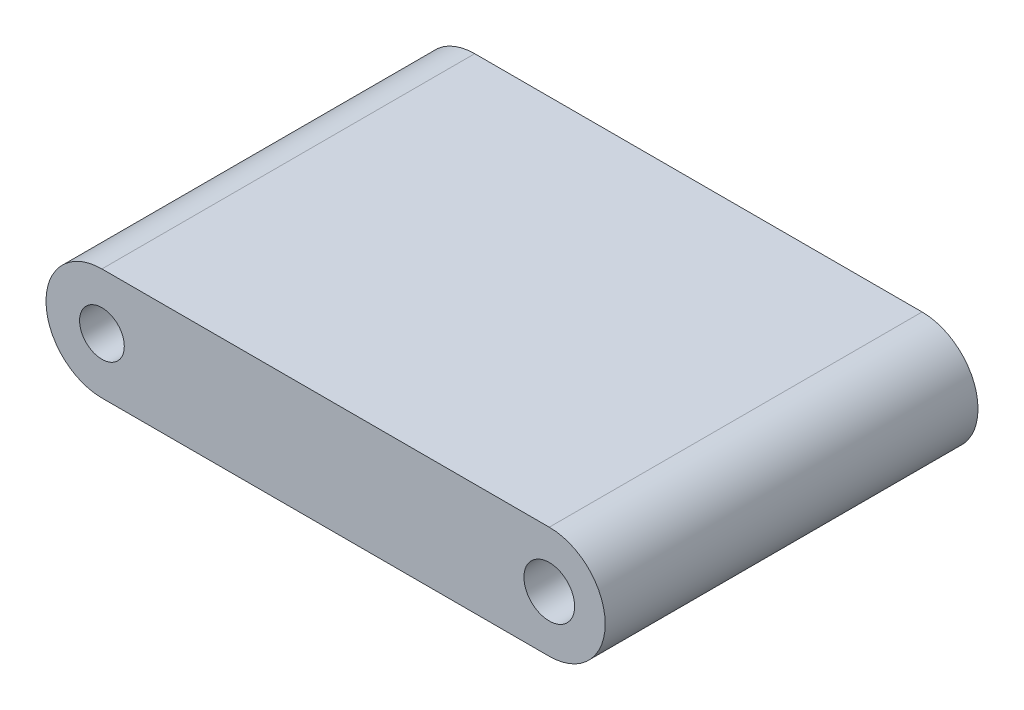
from build123d import *

# Parameters (mm, degrees)
SKETCH1_R           = 1.905
SKETCH1_R_2         = 2.159
BOSS_EXTRUDE1_DEPTH = 31.75


with BuildPart() as part:
    # Sketch1 → Boss-Extrude1 (new body)
    with BuildSketch(Plane.XY):
        with BuildLine():
            Line((0, 4.7625), (38.1, 4.7625))
            ThreePointArc((38.1, 4.7625), (42.8625, 0), (38.1, -4.7625))
            Line((38.1, -4.7625), (0, -4.7625))
            ThreePointArc((0, -4.7625), (-4.7625, 0), (0, 4.7625))
        make_face()
        Circle(SKETCH1_R, mode=Mode.SUBTRACT)
        with Locations((38.1, 0)):
            Circle(SKETCH1_R_2, mode=Mode.SUBTRACT)
    extrude(amount=BOSS_EXTRUDE1_DEPTH)


solid = part.part
